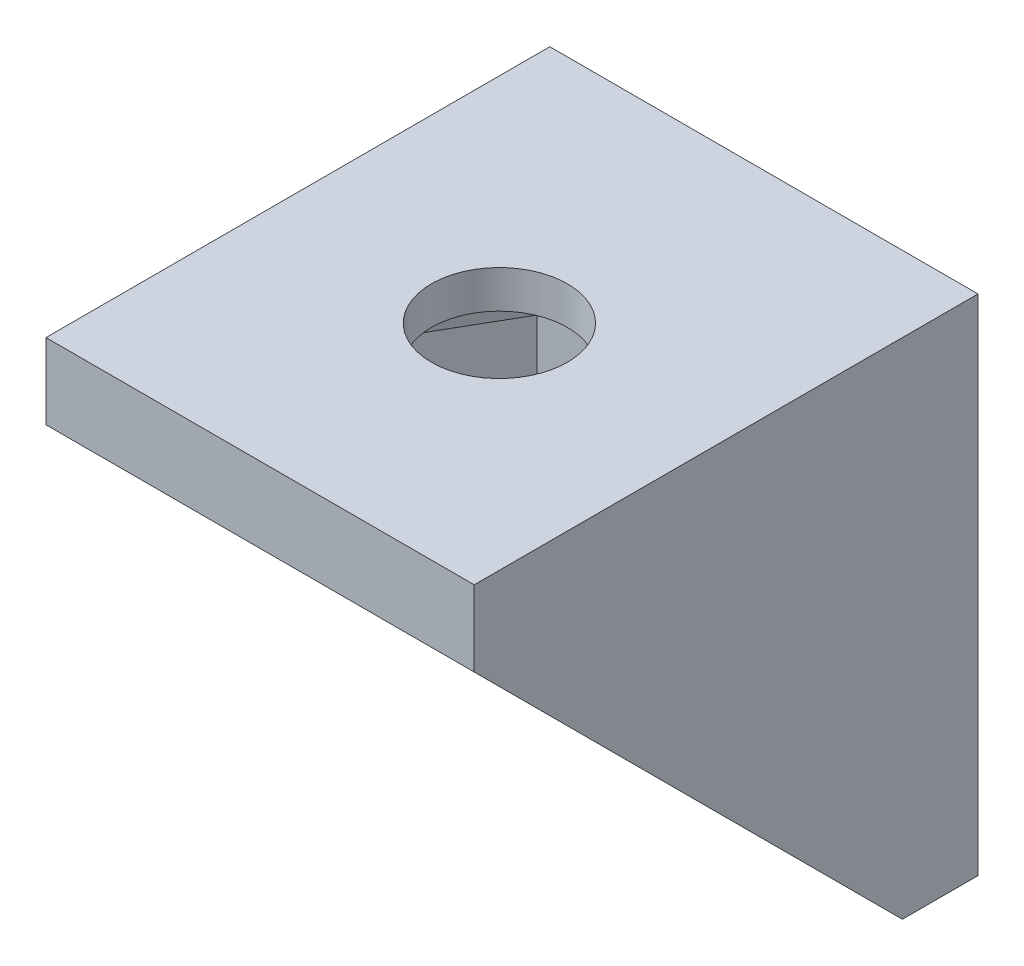
from build123d import *

# Parameters (mm, degrees)
BOSS_EXTRUDE1_DEPTH   = 8.5
SKETCH2_W             = 17
SKETCH2_H             = 17
CUT_EXTRUDE1_DEPTH    = 6
CUT_EXTRUDE2_REACH    = 29.591
CORTE_EXTRUS_O1_REACH = 31.534
ESBO_O1_R             = 2.7
CORTE_EXTRUS_O2_DEPTH = 1.5


with BuildPart() as part:
    # Sketch1 → Boss-Extrude1 (new, symmetric)
    with BuildSketch(Plane(origin=(0, 0, 0), x_dir=(0, 0, -1), z_dir=(1, 0, 0))):
        Polygon((0, 0), (-20, 0), (-20, -3), (-11.5, -11.5), (-3, -20), (0, -20), align=None)
    extrude(amount=BOSS_EXTRUDE1_DEPTH, both=True)

    # Sketch2 → Cut-Extrude1 (cut, symmetric)
    with BuildSketch(Plane(origin=(0, 0, 0), x_dir=(0, 0, -1), z_dir=(1, 0, 0))):
        with Locations((-11.5, -11.5)):
            Rectangle(SKETCH2_W, SKETCH2_H)
    extrude(amount=CUT_EXTRUDE1_DEPTH, both=True, mode=Mode.SUBTRACT)

    # Sketch3 → Cut-Extrude2 (cut, up to next)
    with BuildSketch(Plane.XY.offset(3), mode=Mode.PRIVATE) as cut_extrude2_sk1:
        with BuildLine():
            Line((-3, -9), (-3, -12))
            ThreePointArc((-3, -12), (0, -15), (3, -12))
            Line((3, -12), (3, -9))
            ThreePointArc((3, -9), (0, -6), (-3, -9))
        make_face()
    cut_extrude2_tool1 = extrude(cut_extrude2_sk1.sketch, amount=-CUT_EXTRUDE2_REACH, mode=Mode.PRIVATE) & part.part
    add(cut_extrude2_tool1.solids().sort_by_distance((0, -10.5, 3))[0], mode=Mode.SUBTRACT)

    # Esboço1 → Corte-extrusão1 (cut, up to next)
    with BuildSketch(Plane(origin=(0, 0, 0), x_dir=(1, 0, 0), z_dir=(0, 1, 0)), mode=Mode.PRIVATE) as corte_extrus_o1_sk1:
        with Locations((0, -10.5)):
            Circle(ESBO_O1_R)
    corte_extrus_o1_tool1 = extrude(corte_extrus_o1_sk1.sketch, amount=-CORTE_EXTRUS_O1_REACH, mode=Mode.PRIVATE) & part.part
    add(corte_extrus_o1_tool1.solids().sort_by_distance((0, 0, 10.5))[0], mode=Mode.SUBTRACT)

    # Esboço3 → Corte-extrusão2 (cut)
    with BuildSketch(Plane.XZ.offset(3)):
        Polygon((0, 14.7), (-2.424871131, 14.7), (-3.637306696, 12.6), (-4.849742261, 10.5), (-3.637306696, 8.4), (-2.424871131, 6.3), (0, 6.3), (2.424871131, 6.3), (3.637306696, 8.4), (4.849742261, 10.5), (3.637306696, 12.6), (2.424871131, 14.7), align=None)
    extrude(amount=-CORTE_EXTRUS_O2_DEPTH, mode=Mode.SUBTRACT)


solid = part.part
